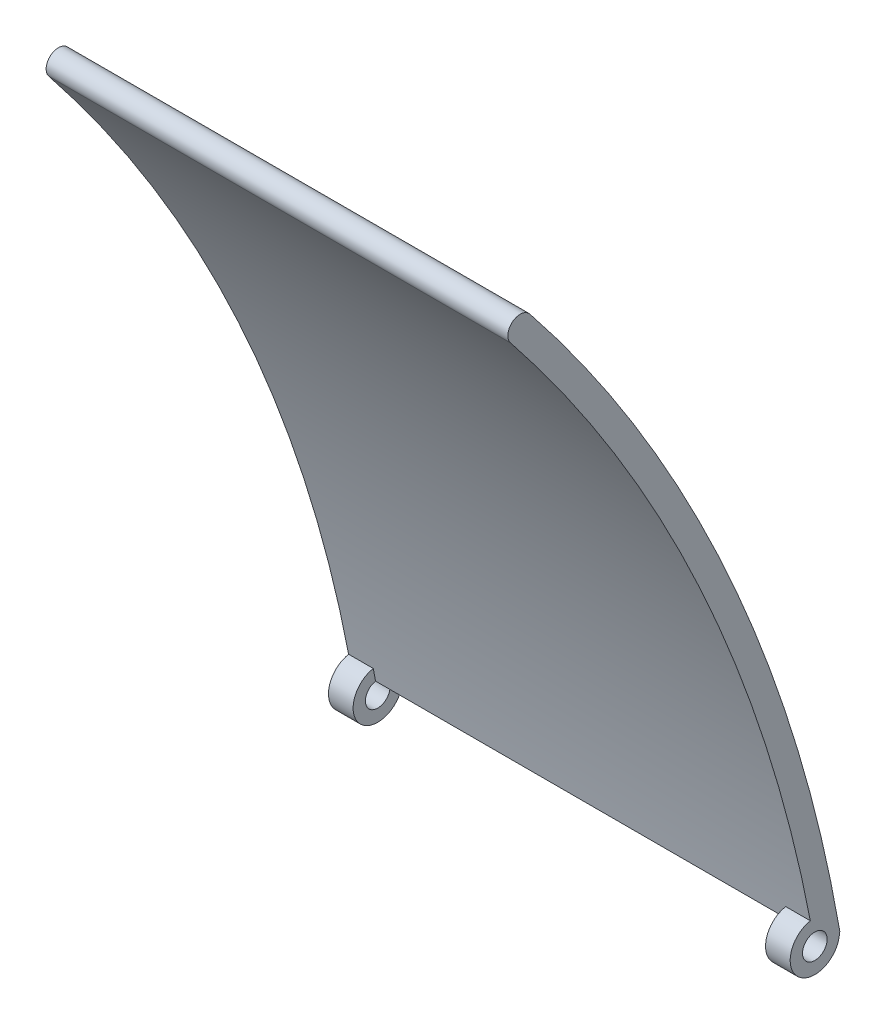
from build123d import *

# Parameters (mm, degrees)
BOSS_EXTRUDE8_DEPTH = 46.84
SKETCH10_R          = 5
BOSS_EXTRUDE9_DEPTH = 5
SKETCH11_R          = 2.5
CUT_EXTRUDE4_DEPTH  = 183.147895593


with BuildPart() as part:
    # Sketch9 → Boss-Extrude8 (new, symmetric)
    with BuildSketch(Plane(origin=(0, 0, 0), x_dir=(0, 0, -1), z_dir=(1, 0, 0))):
        with BuildLine():
            Line((0, 0), (-0.173648178, 0.984807753))
            ThreePointArc((-0.173648178, 0.984807753), (-22.828245747, 74.423796966), (-62.906637971, 140))
            ThreePointArc((-62.906637971, 140), (-66.419974037, 140.395562491), (-66.815536529, 136.882226425))
            ThreePointArc((-66.815536529, 136.882226425), (-27.385689632, 72.367172247), (-5.097686943, 0.116566865))
            Line((-5.097686943, 0.116566865), (-5.077133059, 0))
            Line((-5.077133059, 0), (0, 0))
        make_face()
    extrude(amount=BOSS_EXTRUDE8_DEPTH, both=True)

    # Sketch10 → Boss-Extrude9 (add)
    with BuildSketch(Plane(origin=(46.84, 0, 0), x_dir=(0, 0, -1), z_dir=(1, 0, 0))):
        with Locations((-5.077133059, 0)):
            Circle(SKETCH10_R)
    boss_extrude9 = extrude(amount=-BOSS_EXTRUDE9_DEPTH)

    # Mirror1: Boss-Extrude9 across plane
    add(boss_extrude9.mirror(Plane(origin=(0, 0, 0), x_dir=(0, 0, 1), z_dir=(1, 0, 0))))

    # Sketch11 → Cut-Extrude4 (cut, through all)
    with BuildSketch(Plane(origin=(46.84, 0, 0), x_dir=(0, 0, -1), z_dir=(1, 0, 0))):
        with Locations((-5.077133059, 0)):
            Circle(SKETCH11_R)
    extrude(amount=-CUT_EXTRUDE4_DEPTH, mode=Mode.SUBTRACT)


solid = part.part
